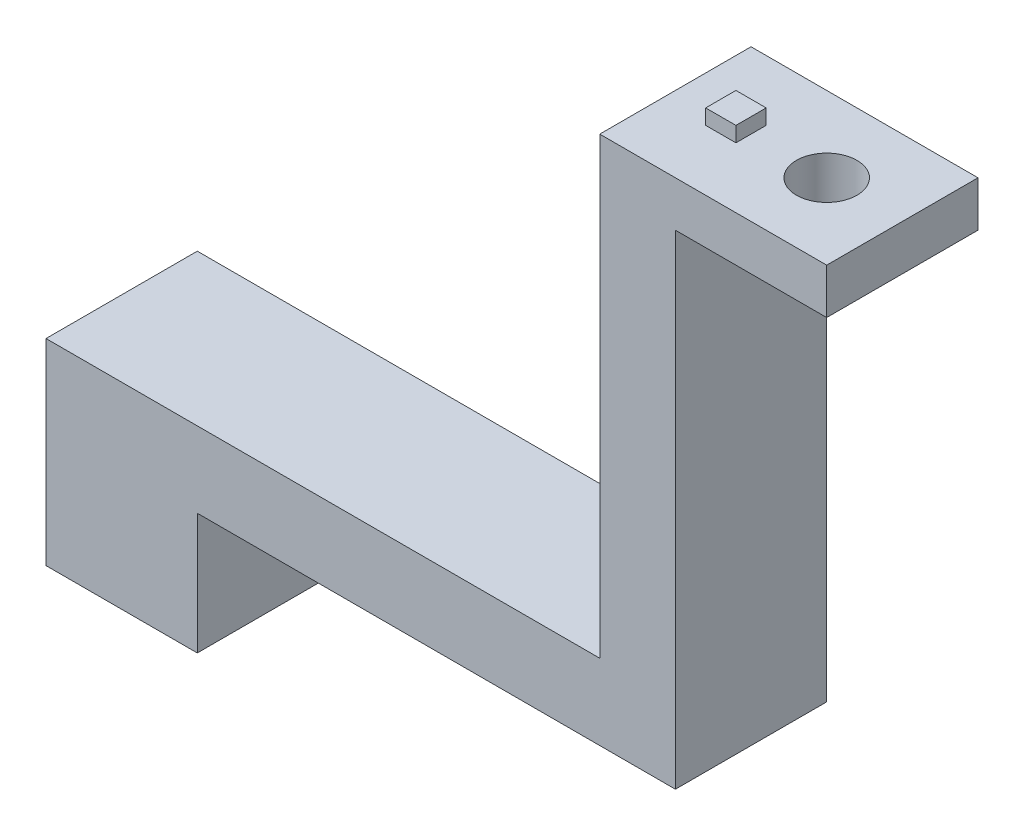
from build123d import *

# Parameters (mm, degrees)
BOSS_EXTRUDE1_DEPTH = 10
SKETCH2_W           = 5.1
SKETCH2_H           = 3.1
CUT_EXTRUDE1_DEPTH  = 10
SKETCH3_W           = 2
SKETCH3_H           = 2
BOSS_EXTRUDE2_DEPTH = 1
CUT_EXTRUDE4_REACH  = 69.908
SKETCH11_R          = 2


with BuildPart() as part:
    # Sketch1 → Boss-Extrude1 (new body)
    with BuildSketch(Plane.XY):
        Polygon((10, 13), (36.6, 13), (36.6, 43), (51.6, 43), (51.6, 40), (41.6, 40), (41.6, 8), (10, 8), (10, 0), (0, 0), (0, 13), align=None)
    extrude(amount=BOSS_EXTRUDE1_DEPTH)

    # Sketch2 → Cut-Extrude1 (cut)
    with BuildSketch(Plane.XZ):
        with Locations((5, 5)):
            Rectangle(SKETCH2_W, SKETCH2_H)
    extrude(amount=-CUT_EXTRUDE1_DEPTH, mode=Mode.SUBTRACT)

    # Sketch3 → Boss-Extrude2 (add)
    with BuildSketch(Plane(origin=(0, 43, 0), x_dir=(1, 0, 0), z_dir=(0, 1, 0))):
        with Locations((40.6, -5)):
            Rectangle(SKETCH3_W, SKETCH3_H)
    extrude(amount=BOSS_EXTRUDE2_DEPTH)

    # Sketch11 → Cut-Extrude4 (cut, up to next)
    with BuildSketch(Plane(origin=(0, 43, 0), x_dir=(1, 0, 0), z_dir=(0, 1, 0)), mode=Mode.PRIVATE) as cut_extrude4_sk1:
        with Locations((46.6, -5)):
            Circle(SKETCH11_R)
    cut_extrude4_tool1 = extrude(cut_extrude4_sk1.sketch, amount=-CUT_EXTRUDE4_REACH, mode=Mode.PRIVATE) & part.part
    add(cut_extrude4_tool1.solids().sort_by_distance((46.6, 43, 5))[0], mode=Mode.SUBTRACT)


solid = part.part
